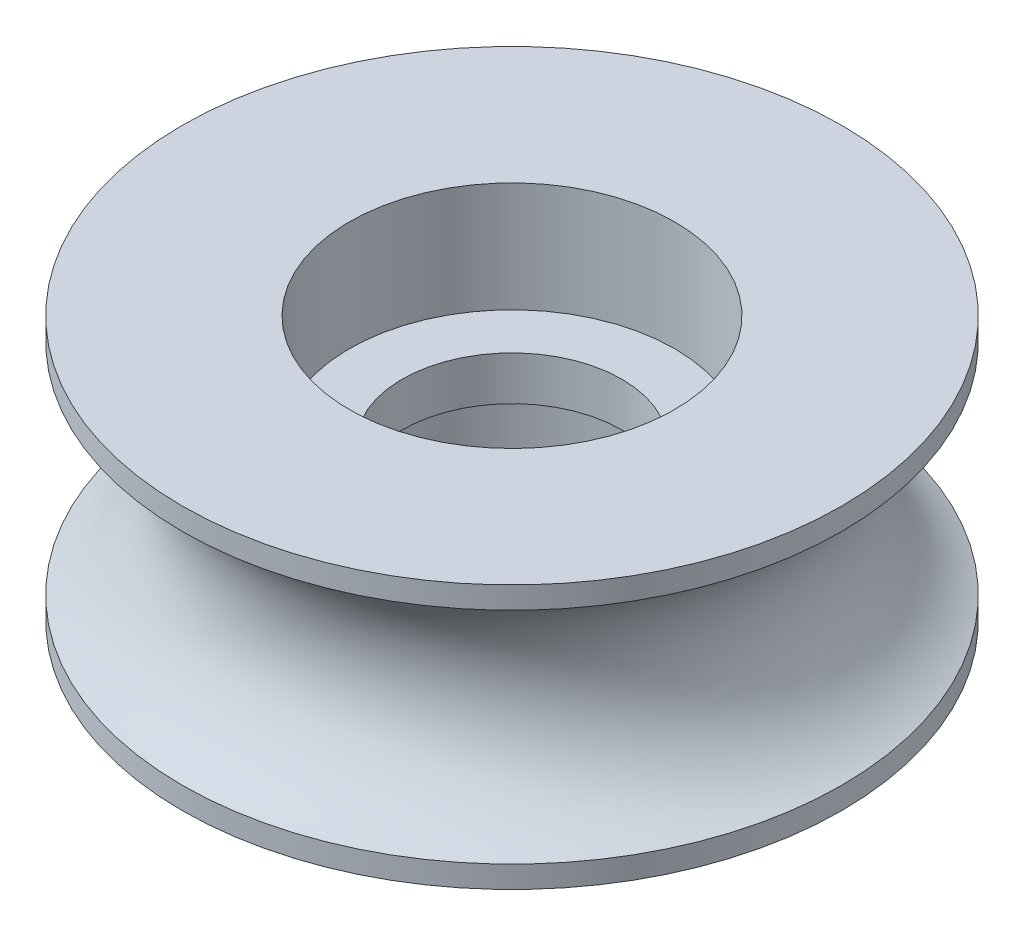
from build123d import *


with BuildPart() as part:
    # Sketch1 → Revolve1 (revolve)
    with BuildSketch(Plane.XY):
        with BuildLine():
            Line((-3.7, 0), (-7.5, 0))
            Line((-7.5, 0), (-7.5, 0.5))
            ThreePointArc((-7.5, 0.5), (-5.819803903, 3), (-7.5, 5.5))
            Line((-7.5, 5.5), (-7.5, 6))
            Line((-7.5, 6), (-3.7, 6))
            Line((-3.7, 6), (-3.7, 3.5))
            Line((-3.7, 3.5), (-2.5, 3.5))
            Line((-2.5, 3.5), (-2.5, 2.5))
            Line((-2.5, 2.5), (-3.7, 2.5))
            Line((-3.7, 2.5), (-3.7, 0))
        make_face()
    revolve(axis=Axis((0, -6.629530881, 0), (0, 1, 0)))


solid = part.part
